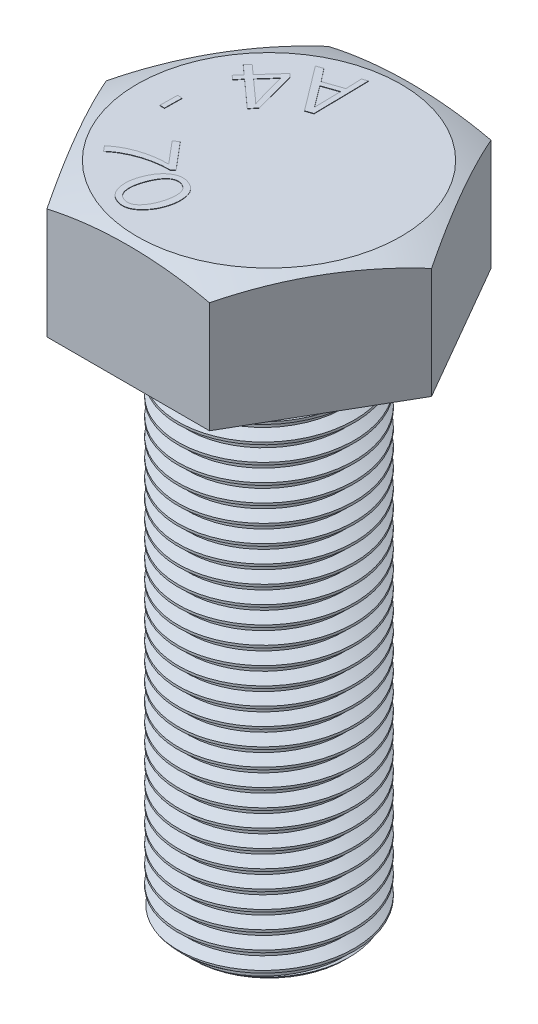
from build123d import *

# Parameters (mm, degrees)
BOSS_EXTRUDE1_DEPTH      = 0.0001
BOSS_EXTRUDE1_DEPTH_BACK = 3.5
SKETCH3_R                = 3.8
BOSS_EXTRUDE2_DEPTH      = 0.1
SKETCH4_R                = 2.5
BOSS_EXTRUDE3_DEPTH      = 1
FILLET1_R                = 0.5
SKETCH5_R                = 2.5
BOSS_EXTRUDE4_DEPTH      = 14
THREAD1_PITCH            = 0.5
BOSS_EXTRUDE7_DEPTH      = 0.01


with BuildPart() as part:
    # Sketch1 → Boss-Extrude1 (new, two sides: drawn at the far end of the back side and taken through both)
    with BuildSketch(Plane(origin=(0, 0, 0), x_dir=(1, 0, 0), z_dir=(0, 1, 0)).offset(-BOSS_EXTRUDE1_DEPTH_BACK)):
        Polygon((2.309401077, -4), (4.618802154, 0), (2.309401077, 4), (-2.309401077, 4), (-4.618802154, 0), (-2.309401077, -4), align=None)
    extrude(amount=BOSS_EXTRUDE1_DEPTH + BOSS_EXTRUDE1_DEPTH_BACK)

    # Sketch2 → Cut-Revolve1 (revolve, cut)
    with BuildSketch(Plane.XY, mode=Mode.PRIVATE) as cut_revolve1_sk:
        with BuildLine():
            Line((3.749999999, 0.0001), (4.618802154, 0.0001))
            Line((4.618802154, 0.0001), (4.618802154, -0.3499))
            ThreePointArc((4.618802154, -0.3499), (4.188501179, -0.164722349), (3.749999999, 0.0001))
        make_face()
    revolve(cut_revolve1_sk.sketch.rotate(Axis((0, 55, 0), (0, -1, 0)), 90), axis=Axis((0, 55, 0), (0, -1, 0)), mode=Mode.SUBTRACT)

    # Sketch3 → Boss-Extrude2 (add)
    with BuildSketch(Plane.XZ.offset(3.5)):
        with Locations(Location((0, 0, 0), (0, 0, 270))):
            Circle(SKETCH3_R)
    extrude(amount=BOSS_EXTRUDE2_DEPTH)

    # Sketch4 → Boss-Extrude3 (add)
    with BuildSketch(Plane.XZ.offset(3.6)):
        with Locations(Location((0, 0, 0), (0, 0, 270))):
            Circle(SKETCH4_R)
    extrude(amount=BOSS_EXTRUDE3_DEPTH)

    # Fillet1
    fillet1_edges = [part.edges().sort_by_distance(p)[0] for p in [
        (0, -3.6, 2.5),
    ]]
    fillet(fillet1_edges, radius=FILLET1_R)

    # Sketch19 → Boss-Extrude7 (add)
    # profile 1 of 5: a face of its own
    with BuildSketch(Plane(origin=(0, 0.0001, 0), x_dir=(1, 0, 0), z_dir=(0, 1, 0))):
        Polygon((-1.653720025, 2.970233115), (-1.472404921, 3.032733115), (-1.186597629, 2.667824261), (-0.662509088, 2.848162803), (-0.678459609, 3.305845094), (-0.530022109, 3.356951865), (-0.502027317, 1.782407594), (-0.704501275, 1.712746136), align=None)
        Polygon((-1.103589817, 2.548032594), (-0.651115859, 1.942238324), (-0.665764296, 2.69874874), align=None, mode=Mode.SUBTRACT)
    # profile 2 of 5: a face of its own
    with BuildSketch(Plane(origin=(0, 0.0001, 0), x_dir=(1, 0, 0), z_dir=(0, 1, 0))):
        Polygon((-2.709922116, 1.977130018), (-2.589479408, 2.111570123), (-2.32483097, 1.873939914), (-1.831992429, 2.42309356), (-1.73856795, 2.339434706), (-1.419232012, 1.133380018), (-1.575482012, 0.959226373), (-2.335573158, 1.641192518), (-2.497031491, 1.461505018), (-2.606732012, 1.55981231), (-2.445273679, 1.73949981), align=None)
        with BuildLine():
            Line((-2.21513045, 1.775632623), (-1.689414304, 1.303952935))
            add(Edge.make_bspline(
                [(-1.689414304, 1.303952935), (-1.669799022, 1.2861392), (-1.628990344, 1.249078556), (-1.589272804, 1.21085043), (-1.568646075, 1.190997206)],
                knots=[0, 0, 0, 0, 0.961328931, 2, 2, 2, 2], degree=3))
            add(Edge.make_bspline(
                [(-1.568646075, 1.190997206), (-1.573763795, 1.205747864), (-1.583571551, 1.234016478), (-1.597238409, 1.274314666), (-1.60872103, 1.310820146), (-1.615548053, 1.333784229), (-1.618776283, 1.344643039)],
                knots=[0, 0, 0, 0, 1.159136544, 2.221404997, 3.158972436, 4, 4, 4, 4], degree=3))
            Line((-1.618776283, 1.344643039), (-1.85217472, 2.179929498))
            Line((-1.85217472, 2.179929498), (-2.21513045, 1.775632623))
        make_face(mode=Mode.SUBTRACT)
    # profile 3 of 5: a face of its own
    with BuildSketch(Plane(origin=(0, 0.0001, 0), x_dir=(1, 0, 0), z_dir=(0, 1, 0))):
        Polygon((-2.762276644, -0.206819314), (-2.896391228, -0.204866189), (-2.888904248, 0.291878603), (-2.754789665, 0.289925478), align=None)
    # profile 4 of 5: a face of its own
    with BuildSketch(Plane(origin=(0, 0.0001, 0), x_dir=(1, 0, 0), z_dir=(0, 1, 0))):
        with BuildLine():
            Line((-2.563670359, -2.135835714), (-2.688670359, -1.987398214))
            add(Edge.make_bspline(
                [(-2.688670359, -1.987398214), (-2.664225818, -1.967519636), (-2.615478233, -1.927877547), (-2.539082238, -1.872734256), (-2.459967438, -1.822081682), (-2.378382209, -1.775241472), (-2.293914464, -1.733060603), (-2.207061874, -1.694582208), (-2.117507516, -1.660341378), (-2.025996218, -1.630280871), (-1.933614122, -1.604706607), (-1.842217613, -1.58188083), (-1.751883351, -1.563893055), (-1.663031596, -1.548933215), (-1.575348956, -1.538603989), (-1.488906501, -1.532065819), (-1.403738976, -1.529216968), (-1.347415372, -1.530639323), (-1.319529734, -1.531343526)],
                knots=[0, 0, 0, 0, 1.025613709, 2.04529066, 3.065383636, 4.082806206, 5.106538283, 6.137752087, 7.174325077, 8.226651823, 9.272358319, 10.294510566, 11.292840374, 12.270257028, 13.227229488, 14.166033681, 15.09200907, 16, 16, 16, 16], degree=3))
            Line((-1.319529734, -1.531343526), (-1.846547964, -0.905692484))
            Line((-1.846547964, -0.905692484), (-1.707876089, -0.813244568))
            Line((-1.707876089, -0.813244568), (-1.066600047, -1.574637797))
            Line((-1.066600047, -1.574637797), (-1.152537547, -1.647228943))
            add(Edge.make_bspline(
                [(-1.152537547, -1.647228943), (-1.187378244, -1.647814138), (-1.256358335, -1.64897275), (-1.358655581, -1.65563524), (-1.458760374, -1.66606701), (-1.556807728, -1.680097298), (-1.65301239, -1.697452241), (-1.746992071, -1.719428754), (-1.838890174, -1.744759862), (-1.928364919, -1.773715877), (-2.014906961, -1.805944279), (-2.098408667, -1.840335336), (-2.178255515, -1.877453579), (-2.254585257, -1.9172569), (-2.327419126, -1.959422142), (-2.396682218, -2.004236665), (-2.462556702, -2.051208791), (-2.504051972, -2.084944208), (-2.524607859, -2.101656026)],
                knots=[0, 0, 0, 0, 1.134935792, 2.247026604, 3.338005499, 4.412699654, 5.472710442, 6.521280469, 7.555442538, 8.577074002, 9.583577015, 10.562915579, 11.518029813, 12.450770261, 13.366178901, 14.258344465, 15.137220334, 16, 16, 16, 16], degree=3))
            add(Edge.make_bspline(
                [(-2.524607859, -2.101656026), (-2.53015399, -2.106416274), (-2.543283363, -2.117685224), (-2.556206332, -2.12919051), (-2.563670359, -2.135835714)],
                knots=[0, 0, 0, 0, 0.844843292, 2, 2, 2, 2], degree=3))
        make_face()
    # profile 5 of 5: a face of its own
    with BuildSketch(Plane(origin=(0, 0.0001, 0), x_dir=(1, 0, 0), z_dir=(0, 1, 0))):
        with BuildLine():
            add(Edge.make_bspline(
                [(-1.134443749, -3.169862793), (-1.154193404, -3.161980218), (-1.192786704, -3.146576679), (-1.246179944, -3.115781686), (-1.293923069, -3.079515176), (-1.336472024, -3.037698569), (-1.373372184, -2.990314513), (-1.40442404, -2.937213489), (-1.430232669, -2.878923853), (-1.450125836, -2.81565967), (-1.464174958, -2.74889216), (-1.4729243, -2.680092665), (-1.47640916, -2.609643357), (-1.473021868, -2.537839553), (-1.465131712, -2.464330926), (-1.450421895, -2.389588012), (-1.430690575, -2.313100414), (-1.413426064, -2.262424808), (-1.404626041, -2.236594564)],
                knots=[0, 0, 0, 0, 0.940757679, 1.83835838, 2.719656118, 3.589521902, 4.472873965, 5.371156104, 6.306942705, 7.290184479, 8.3023896, 9.324560044, 10.358801024, 11.421636714, 12.504690833, 13.629935366, 14.791936548, 16, 16, 16, 16], degree=3))
            add(Edge.make_bspline(
                [(-1.404626041, -2.236594564), (-1.395053458, -2.211513789), (-1.376217693, -2.162162885), (-1.343300506, -2.091566141), (-1.307109352, -2.025545744), (-1.267706451, -1.964128281), (-1.224948259, -1.907424113), (-1.179318375, -1.854912307), (-1.129968069, -1.807361186), (-1.077949191, -1.764467006), (-1.023744581, -1.727617416), (-0.967660331, -1.698467448), (-0.910112123, -1.677944068), (-0.851461945, -1.66439927), (-0.791375959, -1.660227623), (-0.730264967, -1.663096182), (-0.667931309, -1.674111781), (-0.627245294, -1.687671455), (-0.606448957, -1.694602376)],
                knots=[0, 0, 0, 0, 1.192691954, 2.346834404, 3.458232057, 4.53628441, 5.586500365, 6.611654626, 7.624452987, 8.628350799, 9.604631839, 10.531958648, 11.428809849, 12.313221494, 13.198211324, 14.09613777, 15.026855777, 16, 16, 16, 16], degree=3))
            add(Edge.make_bspline(
                [(-0.606448957, -1.694602376), (-0.585161954, -1.70298487), (-0.543641669, -1.719334918), (-0.486603876, -1.751996053), (-0.435917575, -1.789898213), (-0.391864822, -1.833604563), (-0.354450699, -1.882771128), (-0.323941726, -1.937659946), (-0.299841101, -1.997827413), (-0.282708491, -2.062859644), (-0.271265178, -2.130786256), (-0.264861808, -2.200208511), (-0.262990779, -2.270497227), (-0.26724047, -2.341508469), (-0.275809256, -2.413466498), (-0.290559078, -2.486095371), (-0.309430944, -2.55983384), (-0.326160474, -2.608443423), (-0.334639062, -2.633078939)],
                knots=[0, 0, 0, 0, 1.003090979, 1.956528322, 2.874760526, 3.773934785, 4.671227752, 5.577437713, 6.521971659, 7.508601336, 8.523337993, 9.542234956, 10.566471871, 11.606291523, 12.661925884, 13.744462943, 14.856885525, 16, 16, 16, 16], degree=3))
            add(Edge.make_bspline(
                [(-0.334639062, -2.633078939), (-0.343796272, -2.656957699), (-0.361836813, -2.704001034), (-0.393397381, -2.771599654), (-0.429149298, -2.834958828), (-0.46812267, -2.894695104), (-0.510919827, -2.95038682), (-0.556881935, -3.002552786), (-0.60691, -3.050362573), (-0.659658793, -3.094166327), (-0.714950006, -3.13188965), (-0.77173782, -3.162356783), (-0.829949899, -3.183948823), (-0.889084379, -3.197953335), (-0.949353056, -3.203476298), (-1.010612049, -3.200668057), (-1.072942498, -3.190056111), (-1.113644643, -3.17669197), (-1.134443749, -3.169862793)],
                knots=[0, 0, 0, 0, 1.142311651, 2.250458108, 3.329151286, 4.389963848, 5.434176906, 6.46434324, 7.492865909, 8.522564522, 9.524222491, 10.478337171, 11.394059112, 12.290053164, 13.185798031, 14.088272758, 15.023092812, 16, 16, 16, 16], degree=3))
        make_face()
        with BuildLine():
            add(Edge.make_bspline(
                [(-1.083336978, -3.031190918), (-1.068678586, -3.035912644), (-1.04008077, -3.045124504), (-0.996382598, -3.052264014), (-0.953696843, -3.05357937), (-0.912218015, -3.047617645), (-0.871605033, -3.036705947), (-0.83232309, -3.018765013), (-0.794337578, -2.994625051), (-0.757747636, -2.964815625), (-0.722447109, -2.930405132), (-0.689073051, -2.891800915), (-0.657033244, -2.850005944), (-0.626736104, -2.804707252), (-0.598387881, -2.75560213), (-0.571835589, -2.70297533), (-0.546973264, -2.646791205), (-0.532258503, -2.607763947), (-0.524743228, -2.587831543)],
                knots=[0, 0, 0, 0, 0.925206878, 1.805034018, 2.653712135, 3.483509203, 4.316380553, 5.175211786, 6.069730933, 7.016643961, 8.008959468, 9.031214768, 10.083347352, 11.174863775, 12.306595614, 13.491628336, 14.718898481, 16, 16, 16, 16], degree=3))
            add(Edge.make_bspline(
                [(-0.524743228, -2.587831543), (-0.517032864, -2.565768053), (-0.501945533, -2.522595107), (-0.483557607, -2.457981279), (-0.468322838, -2.395385299), (-0.457208271, -2.334518695), (-0.450060393, -2.2753796), (-0.446265865, -2.218096523), (-0.44671509, -2.162634553), (-0.450272258, -2.109368411), (-0.458384488, -2.059185799), (-0.471790981, -2.013028322), (-0.490017027, -1.971155038), (-0.513535257, -1.933773193), (-0.542269012, -1.900940803), (-0.576357106, -1.873223019), (-0.614998487, -1.849323889), (-0.643573227, -1.837848753), (-0.65820677, -1.831972168)],
                knots=[0, 0, 0, 0, 1.311452242, 2.566196875, 3.768522411, 4.925979987, 6.036341302, 7.110232792, 8.145512231, 9.146905107, 10.104007543, 10.992384264, 11.8376352, 12.65873906, 13.461342585, 14.274595325, 15.116395032, 16, 16, 16, 16], degree=3))
            add(Edge.make_bspline(
                [(-0.65820677, -1.831972168), (-0.67274933, -1.827221287), (-0.700994879, -1.817993803), (-0.744331309, -1.811251911), (-0.786601243, -1.810083643), (-0.828077328, -1.815186581), (-0.868287152, -1.827394715), (-0.907509872, -1.845026233), (-0.945817105, -1.868898292), (-0.982453786, -1.89904583), (-1.018324002, -1.933767986), (-1.051976531, -1.973517169), (-1.084651641, -2.016946033), (-1.115964037, -2.064443937), (-1.145123484, -2.116525586), (-1.173056978, -2.172458199), (-1.199651941, -2.232571102), (-1.215285283, -2.274592464), (-1.223310937, -2.296164876)],
                knots=[0, 0, 0, 0, 0.896250124, 1.740757873, 2.562110688, 3.370585953, 4.180263114, 5.01788192, 5.886933563, 6.819409191, 7.796216421, 8.811824722, 9.871020562, 10.983265038, 12.146245188, 13.370314709, 14.65000439, 16, 16, 16, 16], degree=3))
            add(Edge.make_bspline(
                [(-1.223310937, -2.296164876), (-1.231098031, -2.318671353), (-1.24627401, -2.362533387), (-1.265286966, -2.427768838), (-1.279939834, -2.490709766), (-1.290851321, -2.551201663), (-1.297494738, -2.6092688), (-1.299765191, -2.664856961), (-1.298330565, -2.718089903), (-1.292544263, -2.768638369), (-1.282805231, -2.816160058), (-1.267677922, -2.859578582), (-1.248659511, -2.899133964), (-1.224326364, -2.934095331), (-1.196064872, -2.965364224), (-1.162662585, -2.991770444), (-1.12507794, -3.014417476), (-1.09751581, -3.02549321), (-1.083336978, -3.031190918)],
                knots=[0, 0, 0, 0, 1.367770412, 2.665596797, 3.900703557, 5.078024261, 6.194363486, 7.254761033, 8.271112137, 9.24980961, 10.173922531, 11.051002827, 11.884391959, 12.6865273, 13.489364474, 14.296255433, 15.123539925, 16, 16, 16, 16], degree=3))
        make_face(mode=Mode.SUBTRACT)
    extrude(amount=BOSS_EXTRUDE7_DEPTH)


with BuildPart() as body_2:
    # Sketch5 → Boss-Extrude4 (new body)
    with BuildSketch(Plane.XZ.offset(4.6)):
        with Locations(Location((0, 0, 0), (0, 0, 270))):
            Circle(SKETCH5_R)
    extrude(amount=BOSS_EXTRUDE4_DEPTH)

    # Thread1: the profile of Thread Profile1 profile screwed along a right-hand helix of 38 turns, 6 arcs to a turn; built about Z, then put on its axis
    thread1_z = Axis((0, 0, 0), (0, 0, 1))
    thread1_corners = [(2.5003, 0, -0.000173205), (2.5003, 0, 0.433489356), (2.22, 0, 0.271658075), (2.22, 0, 0.161658075)]
    with BuildLine(mode=Mode.PRIVATE) as thread1_profile:
        Line(thread1_corners[0], thread1_corners[1])
        Line(thread1_corners[1], thread1_corners[2])
        Line(thread1_corners[2], thread1_corners[3])
        Line(thread1_corners[3], thread1_corners[0])
    thread1_cap = Face(thread1_profile.wire())
    thread1_turn_angles = [0, 30, 60, 90, 120, 150, 180, 210, 240, 270, 300, 330, 360, 390, 420, 450, 480, 510, 540, 570, 600, 630, 660, 690, 720]
    thread1_turn_weights = [1, 0.8660254037844387, 1, 0.8660254037844387, 1, 0.8660254037844387, 1, 0.8660254037844387, 1, 0.8660254037844387, 1, 0.8660254037844387, 1, 0.8660254037844387, 1, 0.8660254037844387, 1, 0.8660254037844387, 1, 0.8660254037844387, 1, 0.8660254037844387, 1, 0.8660254037844387, 1]
    thread1_turn_rails = [Edge.make_bspline([Vector(p[0], p[1], 0).rotate(thread1_z, thread1_turn_angles[k]) / thread1_turn_weights[k] + Vector(0, 0, p[2] + THREAD1_PITCH * thread1_turn_angles[k] / 360) for k in range(25)], [0, 0, 0, 1, 1, 2, 2, 3, 3, 4, 4, 5, 5, 6, 6, 7, 7, 8, 8, 9, 9, 10, 10, 11, 11, 12, 12, 12], 2, thread1_turn_weights) for p in thread1_corners]
    thread1_turn_sides = [Face.make_surface_from_curves(thread1_turn_rails[p[0]], thread1_turn_rails[p[1]]) for p in [(0, 1), (1, 2), (2, 3), (3, 0)]]
    thread1 = Plane(origin=(0, -23.6, 0), x_dir=(1, 0, 0), z_dir=(0, 1, 0)) * Solid(Shell([*[p.moved(Location((0, 0, 2 * THREAD1_PITCH * i))) for i in range(19) for p in thread1_turn_sides], thread1_cap, thread1_cap.rotate(thread1_z, 13680).moved(Location((0, 0, THREAD1_PITCH * 13680 / 360)))]))
    add(thread1, mode=Mode.SUBTRACT)

    # Sketch11 → Cut-Revolve2 (revolve, cut)
    with BuildSketch(Plane.XY, mode=Mode.PRIVATE) as cut_revolve2_sk:
        Polygon((2.5, -18.25), (2.15, -18.6), (2.5, -18.6), align=None)
    revolve(cut_revolve2_sk.sketch.rotate(Axis((0, 55, 0), (0, -1, 0)), 90), axis=Axis((0, 55, 0), (0, -1, 0)), mode=Mode.SUBTRACT)


solid = Compound([part.part, body_2.part])
